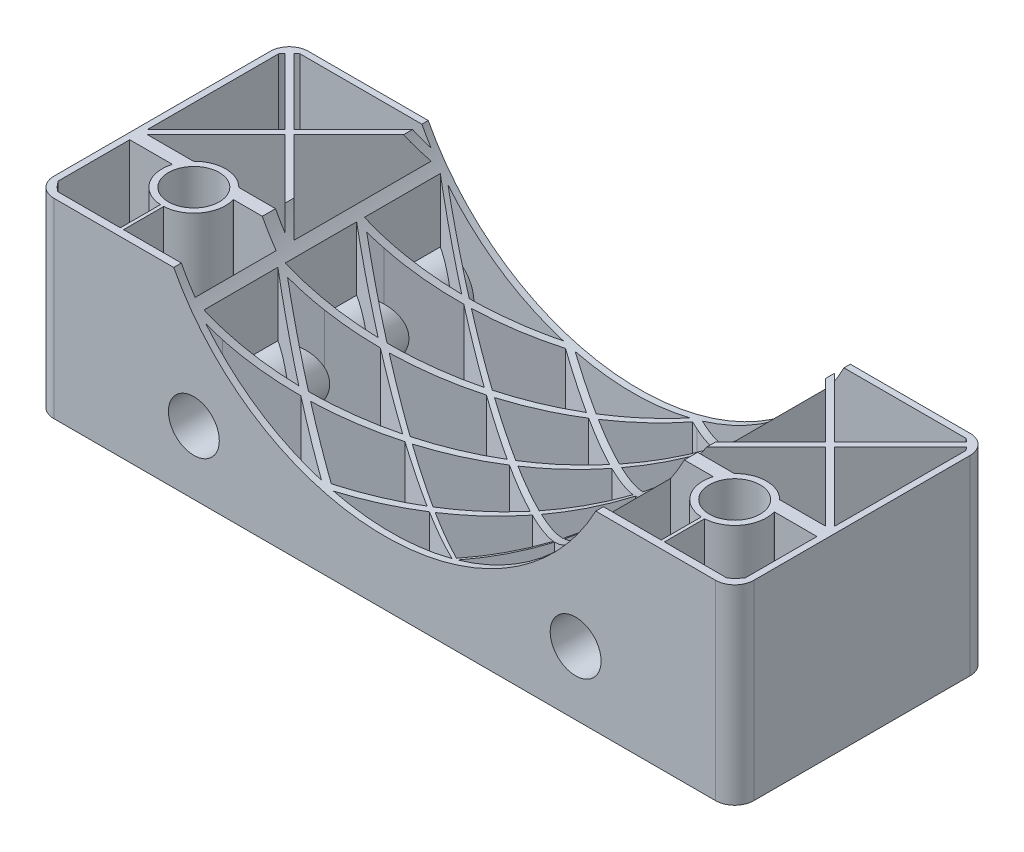
from build123d import *

# Parameters (mm, degrees)
SKETCH1_W           = 110
SKETCH1_H           = 40
BOSS_EXTRUDE1_DEPTH = 30
SKETCH2_R           = 37.5
CUT_EXTRUDE1_DEPTH  = 40
SKETCH3_R           = 4
CUT_EXTRUDE3_DEPTH  = 30
SKETCH7_R           = 4
CUT_EXTRUDE6_DEPTH  = 40
CUT_EXTRUDE7_DEPTH  = 30
CUT_EXTRUDE9_DEPTH  = 30
SKETCH12_R          = 5
BOSS_EXTRUDE3_DEPTH = 40
SKETCH15_R          = 4
CUT_EXTRUDE10_DEPTH = 40
BOSS_EXTRUDE4_DEPTH = 30
FILLET1_R           = 3


with BuildPart() as part:
    # Sketch1 → Boss-Extrude1 (new body)
    with BuildSketch(Plane(origin=(0, 0, 0), x_dir=(1, 0, 0), z_dir=(0, 1, 0))):
        with Locations((55, 20)):
            Rectangle(SKETCH1_W, SKETCH1_H)
    extrude(amount=BOSS_EXTRUDE1_DEPTH)

    # Sketch2 → Cut-Extrude1 (cut)
    with BuildSketch(Plane.XY):
        with Locations((55, 47.5)):
            Circle(SKETCH2_R)
    extrude(amount=-CUT_EXTRUDE1_DEPTH, mode=Mode.SUBTRACT)

    # Sketch3 → Cut-Extrude3 (cut)
    with BuildSketch(Plane.XZ):
        with Locations((12.5, -12.5)):
            Circle(SKETCH3_R)
    cut_extrude3 = extrude(amount=-CUT_EXTRUDE3_DEPTH, mode=Mode.SUBTRACT)

    # Mirror1: Cut-Extrude3 across plane
    add(cut_extrude3.mirror(Plane(origin=(55, 0, 0), x_dir=(0, 0, 1), z_dir=(1, 0, 0))), mode=Mode.SUBTRACT)

    # Sketch7 → Cut-Extrude6 (cut)
    with BuildSketch(Plane.XY):
        with Locations((25, 10)):
            Circle(SKETCH7_R)
        with Locations((85, 10)):
            Circle(SKETCH7_R)
    extrude(amount=-CUT_EXTRUDE6_DEPTH, mode=Mode.SUBTRACT)

    # Sketch9 → Cut-Extrude7 (cut)
    with BuildSketch(Plane.XZ):
        Polygon((1.707106781, -39), (12.5, -28.207106781), (23.292893219, -39), (21.79125531, -39), align=None)
        Polygon((1, -16.707106781), (11.792893219, -27.5), (1, -38.292893219), (1, -36.79125531), align=None)
        with BuildLine():
            Line((23.292893219, -16), (12.5, -26.792893219))
            Line((12.5, -26.792893219), (1.707106781, -16))
            Line((1.707106781, -16), (8.929285786, -16))
            ThreePointArc((8.929285786, -16), (12.5, -17.5), (16.070714214, -16))
            Line((16.070714214, -16), (23.292893219, -16))
        make_face()
        Polygon((24, -38.292893219), (13.207106781, -27.5), (24, -16.707106781), (24, -18.20874469), align=None)
        with BuildLine():
            Line((12.25, -1.199621128), (1, -1.199621128))
            Line((1, -1.199621128), (1, -13.924921606))
            Line((1, -13.924921606), (7.707339109, -13.924921606))
            Line((7.707339109, -13.924921606), (7.68918539, -13.862373953))
            ThreePointArc((7.68918539, -13.862373953), (8.437608263, -9.585043161), (12.25, -7.506253911))
            Line((12.25, -7.506253911), (12.25, -1.199621128))
        make_face()
        with BuildLine():
            Line((17.292660891, -13.924921606), (17.31081461, -13.862373953))
            ThreePointArc((17.31081461, -13.862373953), (16.562391737, -9.585043161), (12.75, -7.506253911))
            Line((12.75, -7.506253911), (12.75, -1.199621128))
            Line((12.75, -1.199621128), (24, -1.199621128))
            Line((24, -1.199621128), (24, -13.924921606))
            Line((24, -13.924921606), (17.292660891, -13.924921606))
        make_face()
        with BuildLine():
            Line((97.25, -1.199621128), (86, -1.199621128))
            Line((86, -1.199621128), (86, -13.924921606))
            Line((86, -13.924921606), (92.707339109, -13.924921606))
            Line((92.707339109, -13.924921606), (92.68918539, -13.862373953))
            ThreePointArc((92.68918539, -13.862373953), (93.437608263, -9.585043161), (97.25, -7.506253911))
            Line((97.25, -7.506253911), (97.25, -1.199621128))
        make_face()
        with BuildLine():
            Line((102.292660891, -13.924921606), (102.31081461, -13.862373953))
            ThreePointArc((102.31081461, -13.862373953), (101.562391737, -9.585043161), (97.75, -7.506253911))
            Line((97.75, -7.506253911), (97.75, -1.199621128))
            Line((97.75, -1.199621128), (109, -1.199621128))
            Line((109, -1.199621128), (109, -13.924921606))
            Line((109, -13.924921606), (102.292660891, -13.924921606))
        make_face()
        with BuildLine():
            Line((93.929285786, -16), (86.707106781, -16))
            Line((86.707106781, -16), (97.5, -26.792893219))
            Line((97.5, -26.792893219), (108.292893219, -16))
            Line((108.292893219, -16), (101.070714214, -16))
            ThreePointArc((101.070714214, -16), (97.5, -17.5), (93.929285786, -16))
        make_face()
        Polygon((86, -38.292893219), (86, -18.20874469), (86, -16.707106781), (96.792893219, -27.5), align=None)
        Polygon((109, -16.707106781), (109, -36.79125531), (109, -38.292893219), (98.207106781, -27.5), align=None)
        Polygon((86.707106781, -39), (88.20874469, -39), (108.292893219, -39), (97.5, -28.207106781), align=None)
    extrude(amount=-CUT_EXTRUDE7_DEPTH, mode=Mode.SUBTRACT)

    # Sketch11 → Cut-Extrude9 (cut)
    with BuildSketch(Plane.XZ):
        Polygon((74.831777691, -6.870491009), (84.013970911, -1), (65.436435115, -1), align=None)
        Polygon((85, -13.007711008), (85, -1.591842697), (75.754730915, -7.447179784), (84.828397962, -13.116678302), align=None)
        Polygon((74.303109193, -7.20848691), (65.00347679, -1.276449032), (55.748894389, -7.18560979), (65.113625115, -13.083639214), align=None)
        Polygon((55.184396802, -6.830081855), (64.570088732, -1), (45.92755138, -1), align=None)
        Polygon((75.037558184, -19.333861561), (84.195449509, -13.51860057), (75.214092745, -7.789583958), (65.986768251, -13.633556138), align=None)
        Polygon((85, -25.608337217), (85, -14.03180623), (81.349745928, -16.510200328), (75.974121895, -19.923721588), align=None)
        Polygon((47.722877132, -3.306365214), (45.005975516, -1.589808553), (35.983357785, -7.364283901), (45.064941258, -13.115953433), (54.24364247, -7.414447377), align=None)
        Polygon((64.184872748, -13.677422452), (54.820920186, -7.778132338), (45.765881351, -13.559882159), (55.111159638, -19.478558407), align=None)
        Polygon((74.104156828, -19.926571422), (65.053474994, -14.224641867), (55.934488469, -20), (64.973366916, -25.724623017), align=None)
        Polygon((35.050950115, -6.773759043), (44.07244862, -1), (25.860015592, -1), (27.529634929, -2.010259425), align=None)
        Polygon((80.649584856, -28.390632809), (84.068474608, -26.204091624), (75.040582112, -20.516519351), (65.907331161, -26.316133705), (74.946238074, -32.04077475), align=None)
        Polygon((54.181077526, -20.073191796), (44.835197816, -14.154134647), (35.728490581, -19.968875355), (45.103769575, -25.876626056), align=None)
        Polygon((85, -38.408157303), (85, -26.790952621), (82.228397155, -28.567458704), (75.878645743, -32.631299607), align=None)
        Polygon((64.040106421, -26.31724343), (55, -20.591842697), (45.881647659, -26.36679918), (54.956574992, -32.085285888), align=None)
        Polygon((44.12138996, -13.702056338), (35.053761926, -7.95922525), (28.423168594, -12.202804983), (25.932883022, -13.794637913), (29.509301375, -16.049907246), (34.886630018, -19.438384226), align=None)
        Polygon((34.121354257, -7.368700393), (25, -1.591842697), (25, -13.206367117), align=None)
        Polygon((44.174383673, -26.470814335), (34.797457648, -20.563350939), (25.961839119, -26.204998289), (27.626895365, -27.28758015), (35.257903909, -32.171425619), align=None)
        Polygon((66.85354378, -37.220099098), (74.016642215, -32.635716099), (64.974070666, -26.908754119), (55.892895673, -32.67530024), (64.990420354, -38.408026471), align=None)
        Polygon((54.025105444, -32.676769051), (44.947934097, -26.958151102), (35.983357785, -32.635716099), (45.001054032, -38.407041698), align=None)
        Polygon((25, -25.579632277), (33.942595105, -20.024787537), (25, -14.390952621), align=None)
        Polygon((65.929850142, -39), (84.065511531, -39), (74.949049885, -33.226240957), (67.451195268, -38.024867912), align=None)
        Polygon((25, -38.729655361), (34.329869874, -32.764749603), (26.854833561, -27.980726362), (25, -26.819143988), align=None)
        Polygon((64.061979967, -39), (54.961530728, -33.26671698), (47.140316953, -38.233187727), (45.92755138, -39), align=None)
        Polygon((42.539405901, -38.01885266), (35.050950115, -33.226240957), (25.934488469, -39), (44.06726143, -39), align=None)
    extrude(amount=-CUT_EXTRUDE9_DEPTH, mode=Mode.SUBTRACT)

    # Sketch12 → Boss-Extrude3 (add)
    with BuildSketch(Plane.XY):
        with Locations((25, 10)):
            Circle(SKETCH12_R)
        with Locations((85, 10)):
            Circle(SKETCH12_R)
    extrude(amount=-BOSS_EXTRUDE3_DEPTH)

    # Sketch15 → Cut-Extrude10 (cut)
    with BuildSketch(Plane.XY):
        with Locations((25, 10)):
            Circle(SKETCH15_R)
        with Locations((85, 10)):
            Circle(SKETCH15_R)
    extrude(amount=-CUT_EXTRUDE10_DEPTH, mode=Mode.SUBTRACT)

    # Sketch16 → Boss-Extrude4 (add)
    with BuildSketch(Plane(origin=(0, 30, 0), x_dir=(1, 0, 0), z_dir=(0, 1, 0))):
        with BuildLine():
            Line((0, 0), (6, 0))
            ThreePointArc((6, 0), (1.757359313, 1.757359313), (0, 6))
            Line((0, 6), (0, 0))
        make_face()
        with BuildLine():
            Line((0, 40), (0, 34))
            ThreePointArc((0, 34), (1.757359313, 38.242640687), (6, 40))
            Line((6, 40), (0, 40))
        make_face()
        with BuildLine():
            Line((110, 40), (104, 40))
            ThreePointArc((104, 40), (108.242640687, 38.242640687), (110, 34))
            Line((110, 34), (110, 40))
        make_face()
        with BuildLine():
            Line((110, 0), (110, 6))
            ThreePointArc((110, 6), (108.242640687, 1.757359313), (104, 0))
            Line((104, 0), (110, 0))
        make_face()
    extrude(amount=-BOSS_EXTRUDE4_DEPTH)

    # Fillet1
    fillet1_edges = [part.edges().sort_by_distance(p)[0] for p in [
        (0, 15, -40),
        (110, 15, -40),
        (110, 15, 0),
        (0, 15, 0),
    ]]
    fillet(fillet1_edges, radius=FILLET1_R)


solid = part.part
